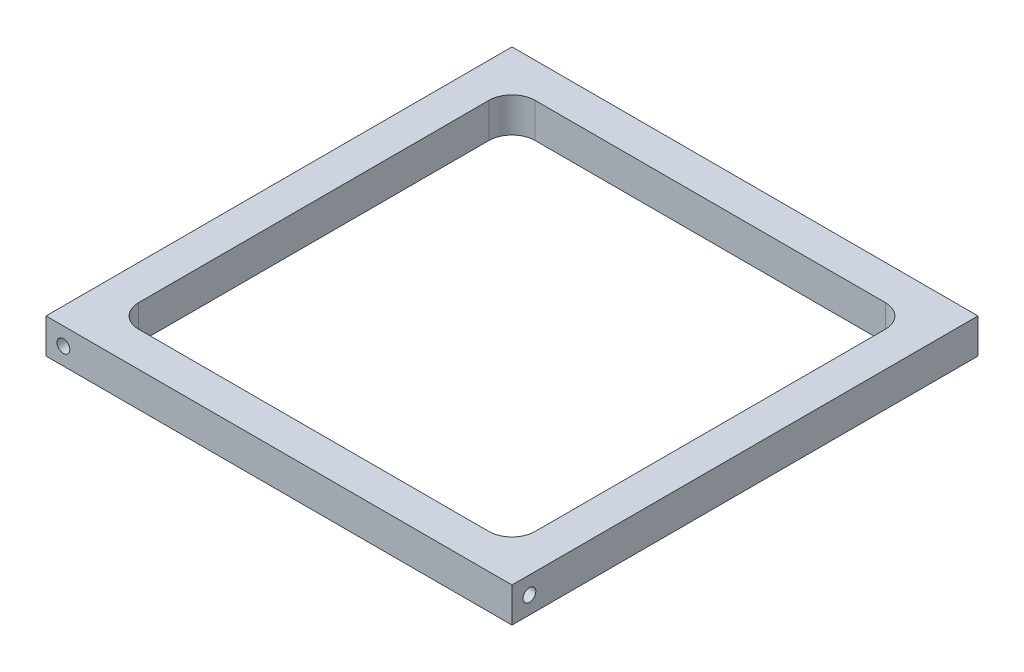
from build123d import *

# Parameters (mm, degrees)
SKETCH1_W           = 127.635
SKETCH1_H           = 127.635
BOSS_EXTRUDE1_DEPTH = 9.525
SKETCH5_W           = 108.585
SKETCH5_H           = 108.585
CUT_EXTRUDE1_DEPTH  = 9.525
FILLET1_R           = 6.35
SKETCH6_R           = 1.7526
F_6_32_HOLE1_DEPTH  = 6.35
SKETCH7_R           = 1.7526
F_6_32_HOLE2_DEPTH  = 6.35
SKETCH8_R           = 1.7526
F_6_32_HOLE3_DEPTH  = 6.35
SKETCH9_R           = 1.7526
F_6_32_HOLE4_DEPTH  = 6.35


with BuildPart() as part:
    # Sketch1 → Boss-Extrude1 (new body)
    with BuildSketch(Plane(origin=(0, 0, 0), x_dir=(1, 0, 0), z_dir=(0, 1, 0))):
        with Locations((63.8175, 63.8175)):
            Rectangle(SKETCH1_W, SKETCH1_H)
    extrude(amount=BOSS_EXTRUDE1_DEPTH)

    # Sketch5 → Cut-Extrude1 (cut)
    with BuildSketch(Plane(origin=(0, 9.525, 0), x_dir=(1, 0, 0), z_dir=(0, 1, 0))):
        with Locations((63.8175, 63.8175)):
            Rectangle(SKETCH5_W, SKETCH5_H)
    extrude(amount=-CUT_EXTRUDE1_DEPTH, mode=Mode.SUBTRACT)

    # Fillet1
    fillet1_edges = [part.edges().sort_by_distance(p)[0] for p in [
        (118.11, 4.7625, -9.525),
        (118.11, 4.7625, -118.11),
        (9.525, 4.7625, -118.11),
        (9.525, 4.7625, -9.525),
    ]]
    fillet(fillet1_edges, radius=FILLET1_R)

    # Sketch6 → 6-32 hole1 (cut)
    with BuildSketch(Plane(origin=(127.635, 0, 0), x_dir=(0, 0, -1), z_dir=(1, 0, 0))):
        with Locations((4.7625, 4.7625)):
            Circle(SKETCH6_R)
    extrude(amount=-F_6_32_HOLE1_DEPTH, mode=Mode.SUBTRACT)

    # Sketch7 → 6-32 hole2 (cut)
    with BuildSketch(Plane(origin=(0, 0, -127.635), x_dir=(-1, 0, 0), z_dir=(0, 0, -1))):
        with Locations((-122.8725, 4.7625)):
            Circle(SKETCH7_R)
    extrude(amount=-F_6_32_HOLE2_DEPTH, mode=Mode.SUBTRACT)

    # Sketch8 → 6-32 hole3 (cut)
    with BuildSketch(Plane.ZY):
        with Locations((-122.8725, 4.7625)):
            Circle(SKETCH8_R)
    extrude(amount=-F_6_32_HOLE3_DEPTH, mode=Mode.SUBTRACT)

    # Sketch9 → 6-32 hole4 (cut)
    with BuildSketch(Plane.XY):
        with Locations((4.7625, 4.7625)):
            Circle(SKETCH9_R)
    extrude(amount=-F_6_32_HOLE4_DEPTH, mode=Mode.SUBTRACT)


solid = part.part
